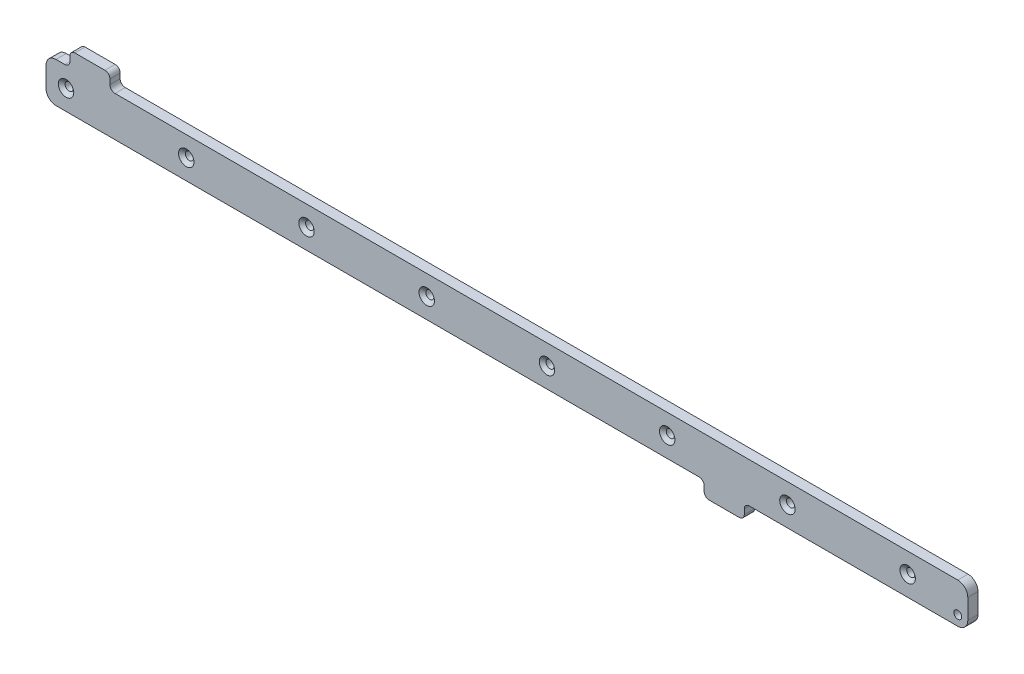
from build123d import *

# Parameters (mm, degrees)
SKETCH1_R                                          = 2.4892
BOSS_EXTRUDE1_DEPTH                                = 6.477
FILLET2_R                                          = 6.35
CSK_FOR_10_FLAT_HEAD_MACHINE_SCREW_100_D           = 5.1054
CSK_FOR_10_FLAT_HEAD_MACHINE_SCREW_100_CSINK_D     = 9.779
CSK_FOR_10_FLAT_HEAD_MACHINE_SCREW_100_CSINK_ANGLE = 100
LPATTERN1_COUNT                                    = 8
LPATTERN1_PITCH                                    = 76.2
FILLET3_R                                          = 3.175


with BuildPart() as part:
    # Sketch1 → Boss-Extrude1 (new body)
    with BuildSketch(Plane.XY):
        Polygon((0, 25.4), (0, 0), (40.53078, 0), (417.140898, 0), (417.140898, -9.525), (442.540898, -9.525), (442.540898, 0), (584.2, 0), (584.2, 25.4), (40.53078, 25.4), (40.53078, 34.925), (15.13078, 34.925), (15.13078, 25.4), align=None)
        with Locations((577.85, 6.35)):
            Circle(SKETCH1_R, mode=Mode.SUBTRACT)
    extrude(amount=BOSS_EXTRUDE1_DEPTH)

    # Fillet2
    fillet2_edges = [part.edges().sort_by_distance(p)[0] for p in [
        (0, 0, 3.2385),
        (0, 25.4, 3.2385),
        (584.2, 0, 3.2385),
        (584.2, 25.4, 3.2385),
    ]]
    fillet(fillet2_edges, radius=FILLET2_R)

    # CSK for #10 Flat Head Machine Screw (100)1 (through all)
    with Locations(Plane.XY.offset(6.477)):
        with Locations((546.1, 12.7)):
            csk_for_10_flat_head_machine_screw_100 = CounterSinkHole(CSK_FOR_10_FLAT_HEAD_MACHINE_SCREW_100_D / 2, CSK_FOR_10_FLAT_HEAD_MACHINE_SCREW_100_CSINK_D / 2, counter_sink_angle=CSK_FOR_10_FLAT_HEAD_MACHINE_SCREW_100_CSINK_ANGLE)

    # LPattern1: CSK for #10 Flat Head Machine Screw (100)1 ×8
    with Locations(*[(-i * LPATTERN1_PITCH, 0, 0) for i in range(1, LPATTERN1_COUNT)]):
        add(csk_for_10_flat_head_machine_screw_100, mode=Mode.SUBTRACT)

    # Fillet3
    fillet3_edges = [part.edges().sort_by_distance(p)[0] for p in [
        (15.13078, 25.4, 3.2385),
        (15.13078, 34.925, 3.2385),
        (40.53078, 34.925, 3.2385),
        (40.53078, 25.4, 3.2385),
        (417.140898, 0, 3.2385),
        (417.140898, -9.525, 3.2385),
        (442.540898, -9.525, 3.2385),
        (442.540898, 0, 3.2385),
    ]]
    fillet(fillet3_edges, radius=FILLET3_R)


solid = part.part
